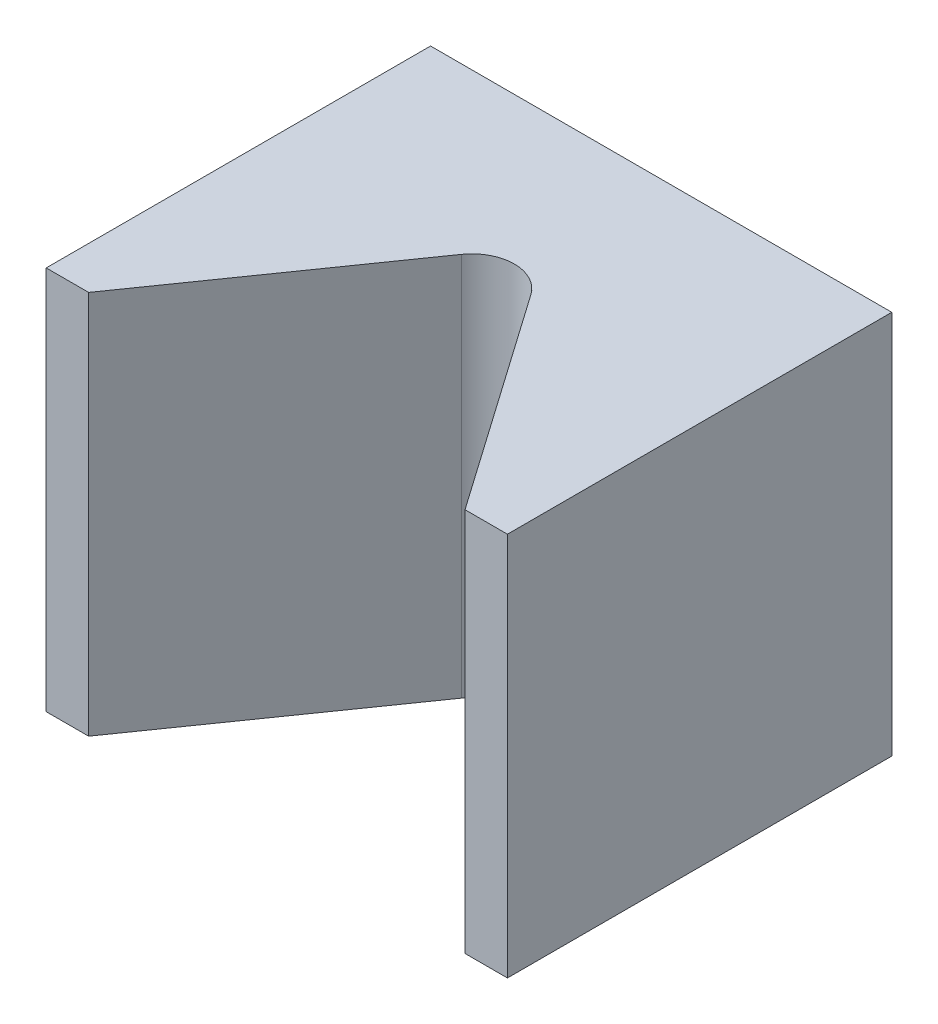
from build123d import *

# Parameters (mm, degrees)
BOSS_EXTRUDE1_DEPTH = 10
SKETCH2_R           = 2.6
CUT_EXTRUDE1_DEPTH  = 2


with BuildPart() as part:
    # Sketch1 → Boss-Extrude1 (new body)
    with BuildSketch(Plane(origin=(0, 0, 0), x_dir=(1, 0, 0), z_dir=(0, 1, 0))):
        with BuildLine():
            Line((0.904649293, 0.632741314), (4.896029025, -5.073854375))
            Line((4.896029025, -5.073854375), (6, -5.073854375))
            Line((6, -5.073854375), (6, 4.926145625))
            Line((6, 4.926145625), (-6, 4.926145625))
            Line((-6, 4.926145625), (-6, -5.073854375))
            Line((-6, -5.073854375), (-4.896029025, -5.073854375))
            Line((-4.896029025, -5.073854375), (-0.904649293, 0.632741314))
            ThreePointArc((-0.904649293, 0.632741314), (0, 1.103970975), (0.904649293, 0.632741314))
        make_face()
    extrude(amount=BOSS_EXTRUDE1_DEPTH)

    # Sketch2 → Cut-Extrude1 (cut)
    with BuildSketch(Plane(origin=(0, 0, -4.926145625), x_dir=(-1, 0, 0), z_dir=(0, 0, -1))):
        with Locations((0, 5)):
            Circle(SKETCH2_R)
    extrude(amount=-CUT_EXTRUDE1_DEPTH, mode=Mode.SUBTRACT)


solid = part.part
